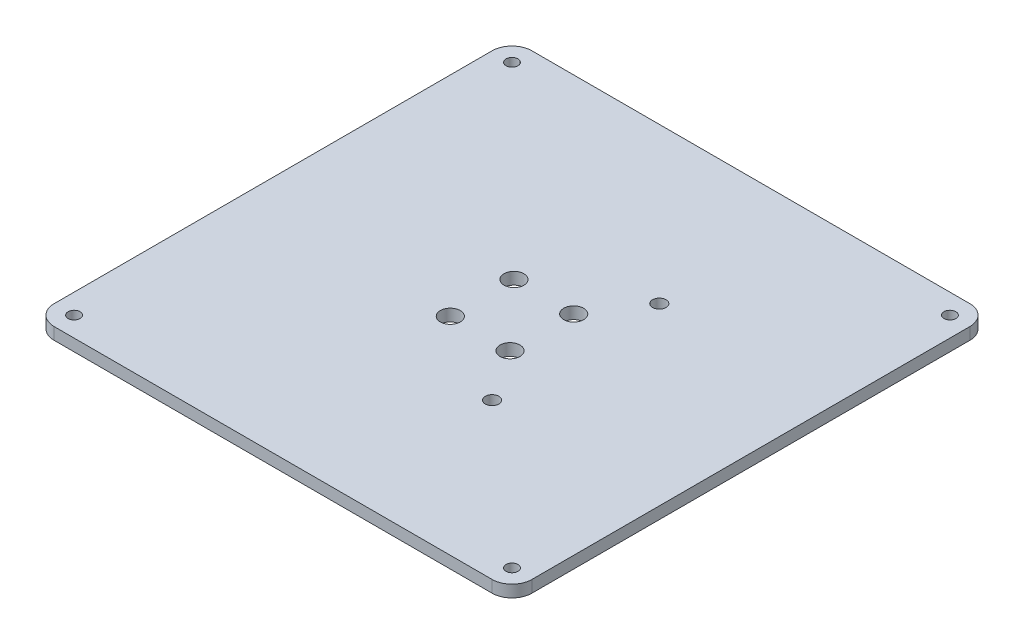
from build123d import *

# Parameters (mm, degrees)
SKETCH1_W                                  = 120
SKETCH1_H                                  = 120
SKETCH1_R                                  = 2.5
BOSS_EXTRUDE1_DEPTH                        = 3
FILLET1_R                                  = 5
SKETCH2_R                                  = 1.5
CUT_EXTRUDE1_DEPTH                         = 85.905830189
MIRROR3_AT_THE_SECOND_PLANE_COPY_1_SKETC_R = 1.5
MIRROR3_AT_THE_SECOND_PLANE_COPY_1_DEPTH   = 85.905830189
SKETCH3_R                                  = 1.7
CUT_EXTRUDE2_DEPTH                         = 85.905830189


with BuildPart() as part:
    # Sketch1 → Boss-Extrude1 (new body)
    with BuildSketch(Plane(origin=(0, 0, 0), x_dir=(1, 0, 0), z_dir=(0, 1, 0))):
        Rectangle(SKETCH1_W, SKETCH1_H)
        with Locations((-7.5, -8)):
            Circle(SKETCH1_R, mode=Mode.SUBTRACT)
        with Locations((7.5, 8)):
            Circle(SKETCH1_R, mode=Mode.SUBTRACT)
        with Locations((7.5, -8)):
            Circle(SKETCH1_R, mode=Mode.SUBTRACT)
        with Locations((-7.5, 8)):
            Circle(SKETCH1_R, mode=Mode.SUBTRACT)
    extrude(amount=BOSS_EXTRUDE1_DEPTH)

    # Fillet1
    fillet1_edges = [part.edges().sort_by_distance(p)[0] for p in [
        (-60, 1.5, -60),
        (60, 1.5, -60),
        (60, 1.5, 60),
        (-60, 1.5, 60),
    ]]
    fillet(fillet1_edges, radius=FILLET1_R)

    # Sketch2 → Cut-Extrude1 (cut, through all)
    with BuildSketch(Plane(origin=(0, 3, 0), x_dir=(1, 0, 0), z_dir=(0, 1, 0))):
        with Locations((-55, 55)):
            Circle(SKETCH2_R)
    cut_extrude1 = extrude(amount=-CUT_EXTRUDE1_DEPTH, mode=Mode.SUBTRACT)

    # Mirror3: Cut-Extrude1 across plane
    add(cut_extrude1.mirror(Plane.XY), mode=Mode.SUBTRACT)

    # Mirror3 at the second plane: Cut-Extrude1 across plane
    add(cut_extrude1.mirror(Plane(origin=(0, 0, 0), x_dir=(0, 0, 1), z_dir=(1, 0, 0))), mode=Mode.SUBTRACT)

    # Mirror3 at the second plane copy 1 sketc → Mirror3 at the second plane copy 1 (cut, through all)
    with BuildSketch(Plane(origin=(0, 3, 0), x_dir=(-1, 0, 0), z_dir=(0, 1, 0))):
        with Locations((-55, 55)):
            Circle(MIRROR3_AT_THE_SECOND_PLANE_COPY_1_SKETC_R)
    extrude(amount=-MIRROR3_AT_THE_SECOND_PLANE_COPY_1_DEPTH, mode=Mode.SUBTRACT)

    # Sketch3 → Cut-Extrude2 (cut, through all)
    with BuildSketch(Plane(origin=(0, 3, 0), x_dir=(1, 0, 0), z_dir=(0, 1, 0))):
        with Locations((16, 21)):
            Circle(SKETCH3_R)
        with Locations((16, -21)):
            Circle(SKETCH3_R)
    extrude(amount=-CUT_EXTRUDE2_DEPTH, mode=Mode.SUBTRACT)


solid = part.part
